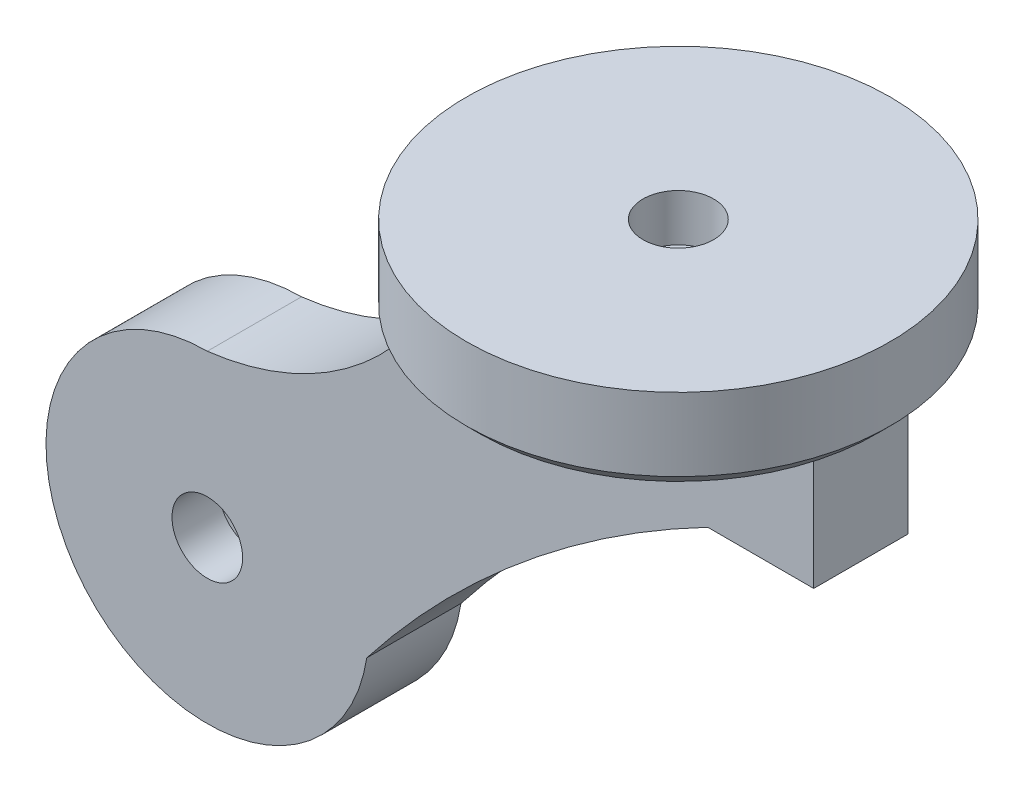
from build123d import *

# Parameters (mm, degrees)
IZIM1_R                        = 90
Y_KSEKLIK_EKSTR_ZYON1_DEPTH    = 37
PAH1_SIZE                      = 6
IZIM2_W                        = 155
IZIM2_H                        = 40
Y_KSEKLIK_EKSTR_ZYON2_DEPTH    = 50
KES_EKSTR_ZYON1_DEPTH          = 151.665191733
Y_KSEKLIK_EKSTR_ZYON4_DEPTH    = 40
Y_KSEKLIK_EKSTR_ZYON5_DEPTH    = 7.5
Y_KSEKLIK_EKSTR_ZYON5_DRAFT    = 70
IZIM14_R                       = 40
Y_KSEKLIK_EKSTR_ZYON6_DEPTH    = 3
IZIM15_R                       = 40
Y_KSEKLIK_EKSTR_ZYON7_DEPTH    = 18
Y_KSEKLIK_EKSTR_ZYON7_TAPER    = 28
KES_EKSTR_ZYON2_REACH          = 366.893
IZIM18_R                       = 1.5
KES_EKSTR_ZYON3_DEPTH          = 5
DAIRESEL_KAPLAMA1_COUNT        = 12
IZIM19_R                       = 22.5
KES_EKSTR_ZYON5_DEPTH          = 7.673092899
KES_EKSTR_ZYON5_DRAFT          = -45
Y_KSEKLIK_EKSTR_ZYON10_DEPTH   = 4
Y_KSEKLIK_EKSTR_ZYON10_DRAFT   = 20
DAIRESEL_KAPLAMA2_COPY_1_DEPTH = 4
DAIRESEL_KAPLAMA2_COPY_1_DRAFT = 20
DAIRESEL_KAPLAMA2_COPY_2_DEPTH = 4
DAIRESEL_KAPLAMA2_COPY_2_DRAFT = 20
DAIRESEL_KAPLAMA2_COPY_3_DEPTH = 4
DAIRESEL_KAPLAMA2_COPY_3_DRAFT = 20
IZIM26_R                       = 11.946565801
Y_KSEKLIK_EKSTR_ZYON16_DEPTH   = 4
Y_KSEKLIK_EKSTR_ZYON16_DRAFT   = -20
IZIM27_R                       = 5
KES_EKSTR_ZYON6_DEPTH          = 4
IZIM28_R                       = 15
KES_EKSTR_ZYON7_DEPTH          = 20
IZIM29_R                       = 15
KES_EKSTR_ZYON8_DEPTH          = 20


with BuildPart() as part:
    # Çizim1 → Yükseklik-Ekstrüzyon1 (new body)
    with BuildSketch(Plane(origin=(0, 0, 0), x_dir=(1, 0, 0), z_dir=(0, 1, 0))):
        with Locations(Location((0, 0, 0), (0, 0, 270))):
            Circle(IZIM1_R)
    extrude(amount=Y_KSEKLIK_EKSTR_ZYON1_DEPTH)

    # Pah1
    pah1_edges = [part.edges().sort_by_distance(p)[0] for p in [
        (0, 0, -90),
    ]]
    chamfer(pah1_edges, length=PAH1_SIZE)

    # Çizim2 → Yükseklik-Ekstrüzyon2 (add)
    with BuildSketch(Plane.XZ):
        Rectangle(IZIM2_W, IZIM2_H)
    extrude(amount=Y_KSEKLIK_EKSTR_ZYON2_DEPTH)

    # Çizim8 → Kes-Ekstrüzyon1 (cut, through all)
    with BuildSketch(Plane(origin=(0, 0, -20), x_dir=(-1, 0, 0), z_dir=(0, 0, -1))):
        with BuildLine():
            Line((77.5, -11), (77.5, -50))
            Line((77.5, -50), (-32.5, -50))
            ThreePointArc((-32.5, -50), (18.551432041, -19.363013449), (77.5, -11))
        make_face()
    extrude(amount=-KES_EKSTR_ZYON1_DEPTH, mode=Mode.SUBTRACT)


with BuildPart() as body_2:
    # Çizim11 → Yükseklik-Ekstrüzyon4 (new body)
    with BuildSketch(Plane(origin=(0, 0, -20), x_dir=(-1, 0, 0), z_dir=(0, 0, -1))):
        with BuildLine():
            ThreePointArc((112.293951988, -170.399089511), (231.983591793, -204.60892494), (180, -91.5))
            ThreePointArc((180, -91.5), (117.428107084, -65.666074831), (77.5, -11))
            ThreePointArc((77.5, -11), (18.551432041, -19.363013449), (-32.5, -50))
            ThreePointArc((-32.5, -50), (46.413512569, -102.362649245), (112.293951988, -170.399089511))
        make_face()
    extrude(amount=-Y_KSEKLIK_EKSTR_ZYON4_DEPTH)


with BuildPart() as y_kseklik_ekstr_zyon5_tool:
    # Çizim12 → Yükseklik-Ekstrüzyon5 (with draft: the straight prism first)
    with BuildSketch(Plane(origin=(0, 0, -20), x_dir=(-1, 0, 0), z_dir=(0, 0, -1))):
        with BuildLine():
            ThreePointArc((77.5, -11), (18.551432041, -19.363013449), (-32.5, -50))
            ThreePointArc((-32.5, -50), (46.413512569, -102.362649245), (112.293951988, -170.399089511))
            ThreePointArc((112.293951988, -170.399089511), (231.983591793, -204.60892494), (180, -91.5))
            ThreePointArc((180, -91.5), (117.428107084, -65.666074831), (77.5, -11))
        make_face()
    extrude(amount=Y_KSEKLIK_EKSTR_ZYON5_DEPTH)
    # Yükseklik-Ekstrüzyon5: the draft: its side faces are tilted about the plane it starts from
    y_kseklik_ekstr_zyon5_sides = [y_kseklik_ekstr_zyon5_tool.faces().sort_by_distance(p)[0] for p in [
        (-18.551432041, -19.363013449, -23.75),
        (-46.413512569, -102.362649245, -23.75),
        (-231.983591793, -204.60892494, -23.75),
        (-117.428107084, -65.666074831, -23.75),
    ]]
    draft(y_kseklik_ekstr_zyon5_sides, Plane(origin=(0, 0, -20), x_dir=(-1, 0, 0), z_dir=(0, 0, -1)), Y_KSEKLIK_EKSTR_ZYON5_DRAFT)


with BuildPart() as part_1:
    add(part.part)

    # Yükseklik-Ekstrüzyon5: add y_kseklik_ekstr_zyon5_tool
    add(y_kseklik_ekstr_zyon5_tool.part)

    add(body_2.part)  # Yükseklik-Ekstrüzyon5 merges body 2

    # Çizim14 → Yükseklik-Ekstrüzyon6 (add)
    with BuildSketch(Plane(origin=(0, 0, -27.5), x_dir=(-1, 0, 0), z_dir=(0, 0, -1))):
        with Locations((178.16629157, -161.872562058)):
            Circle(IZIM14_R)
    extrude(amount=Y_KSEKLIK_EKSTR_ZYON6_DEPTH)

    # Çizim15 → Yükseklik-Ekstrüzyon7 (add)
    with BuildSketch(Plane(origin=(0, 0, -30.5), x_dir=(-1, 0, 0), z_dir=(0, 0, -1))):
        with Locations((178.16629157, -161.872562058)):
            Circle(IZIM15_R)
    extrude(amount=Y_KSEKLIK_EKSTR_ZYON7_DEPTH, taper=Y_KSEKLIK_EKSTR_ZYON7_TAPER)

    # Kes-Ekstrüzyon2: up to this face of the body (flat: up to its plane)
    kes_ekstr_zyon2_end = Plane(part_1.part.faces().sort_by_distance((-113.626570454, -106.060567716, -27.5))[0])
    # Çizim16 → Kes-Ekstrüzyon2 (cut, up to the picked face)
    with BuildSketch(Plane(origin=(0, 0, -48.5), x_dir=(-1, 0, 0), z_dir=(0, 0, -1)), mode=Mode.PRIVATE) as kes_ekstr_zyon2_sk1:
        with BuildLine():
            ThreePointArc((173.362513288, -201.583060849), (178.16629157, -201.872562058), (182.970069853, -201.583060849))
            ThreePointArc((182.970069853, -201.583060849), (182.490394368, -195.947531511), (178.16629157, -192.301792288))
            ThreePointArc((178.16629157, -192.301792288), (173.842188772, -195.947531511), (173.362513288, -201.583060849))
        make_face()
    kes_ekstr_zyon2_tool1 = split(extrude(kes_ekstr_zyon2_sk1.sketch, amount=-KES_EKSTR_ZYON2_REACH, mode=Mode.PRIVATE), bisect_by=kes_ekstr_zyon2_end, keep=Keep.BOTH, mode=Mode.PRIVATE)
    kes_ekstr_zyon2 = kes_ekstr_zyon2_tool1.solids().sort_by(Axis((-178.166292, -197.782755, -48.5), (0, 0, 1)))[0]
    add(kes_ekstr_zyon2, mode=Mode.SUBTRACT)

    # Çizim18 → Kes-Ekstrüzyon3 (cut)
    with BuildSketch(Plane(origin=(0, 0, -27.5), x_dir=(-1, 0, 0), z_dir=(0, 0, -1))):
        with Locations((178.16629157, -196.942426569)):
            Circle(IZIM18_R)
    kes_ekstr_zyon3 = extrude(amount=-KES_EKSTR_ZYON3_DEPTH, mode=Mode.SUBTRACT)

    # Dairesel Kaplama1: Kes-Ekstrüzyon2, Kes-Ekstrüzyon3 ×12 about axis
    dairesel_kaplama1_axis = Axis((-178.16629157, -161.872562058, 0), (0, 0, 1))
    add([kes_ekstr_zyon2.rotate(dairesel_kaplama1_axis, i * 360 / DAIRESEL_KAPLAMA1_COUNT) for i in range(1, DAIRESEL_KAPLAMA1_COUNT)], mode=Mode.SUBTRACT)
    add([kes_ekstr_zyon3.rotate(dairesel_kaplama1_axis, i * 360 / DAIRESEL_KAPLAMA1_COUNT) for i in range(1, DAIRESEL_KAPLAMA1_COUNT)], mode=Mode.SUBTRACT)


with BuildPart() as kes_ekstr_zyon5_tool:
    # Çizim19 → Kes-Ekstrüzyon5 (with draft: the straight prism first)
    with BuildSketch(Plane(origin=(0, 0, -48.5), x_dir=(-1, 0, 0), z_dir=(0, 0, -1))):
        with Locations((178.16629157, -161.872562058)):
            Circle(IZIM19_R)
    extrude(amount=-KES_EKSTR_ZYON5_DEPTH)
    # Kes-Ekstrüzyon5: the draft: its side faces are tilted about the plane it starts from
    kes_ekstr_zyon5_sides = [kes_ekstr_zyon5_tool.faces().sort_by_distance(p)[0] for p in [
        (-155.66629157, -161.872562058, -44.663453551),
    ]]
    draft(kes_ekstr_zyon5_sides, Plane(origin=(0, 0, -48.5), x_dir=(-1, 0, 0), z_dir=(0, 0, -1)), KES_EKSTR_ZYON5_DRAFT)


with BuildPart() as part_2:
    add(part_1.part)

    # Kes-Ekstrüzyon5: cut by kes_ekstr_zyon5_tool
    add(kes_ekstr_zyon5_tool.part, mode=Mode.SUBTRACT)


with BuildPart() as y_kseklik_ekstr_zyon10_tool:
    # Çizim20 → Yükseklik-Ekstrüzyon10 (with draft: the straight prism first)
    with BuildSketch(Plane(origin=(0, 0, -40.826907101), x_dir=(-1, 0, 0), z_dir=(0, 0, -1))):
        with BuildLine():
            ThreePointArc((175.16629157, -153.919575198), (178.16629157, -153.372562058), (181.16629157, -153.919575198))
            Line((181.16629157, -153.919575198), (185.287449999, -143.719350149))
            ThreePointArc((185.287449999, -143.719350149), (178.16629157, -142.372562058), (171.045133141, -143.719350149))
            Line((171.045133141, -143.719350149), (175.16629157, -153.919575198))
        make_face()
    extrude(amount=Y_KSEKLIK_EKSTR_ZYON10_DEPTH)
    # Yükseklik-Ekstrüzyon10: the draft: its side faces are tilted about the plane it starts from
    y_kseklik_ekstr_zyon10_sides = [y_kseklik_ekstr_zyon10_tool.faces().sort_by_distance(p)[0] for p in [
        (-178.16629157, -153.372562058, -42.826907101),
        (-183.226870785, -148.819462674, -42.826907101),
        (-178.16629157, -142.372562058, -42.826907101),
        (-173.105712356, -148.819462674, -42.826907101),
    ]]
    draft(y_kseklik_ekstr_zyon10_sides, Plane(origin=(0, 0, -40.826907101), x_dir=(-1, 0, 0), z_dir=(0, 0, -1)), Y_KSEKLIK_EKSTR_ZYON10_DRAFT)


with BuildPart() as part_3:
    add(part_2.part)

    # Yükseklik-Ekstrüzyon10: add y_kseklik_ekstr_zyon10_tool
    add(y_kseklik_ekstr_zyon10_tool.part)


with BuildPart() as dairesel_kaplama2_copy_1_tool:
    # Dairesel Kaplama2 copy 1 sketch → Dairesel Kaplama2 copy 1 (with draft: the straight prism first)
    with BuildSketch(Plane(origin=(-341.03419606, 15.29838708, -40.826907101), x_dir=(0, -1, 0), z_dir=(0, 0, -1))):
        with BuildLine():
            ThreePointArc((175.16629157, -153.919575198), (178.16629157, -153.372562058), (181.16629157, -153.919575198))
            Line((181.16629157, -153.919575198), (185.287449999, -143.719350149))
            ThreePointArc((185.287449999, -143.719350149), (178.16629157, -142.372562058), (171.045133141, -143.719350149))
            Line((171.045133141, -143.719350149), (175.16629157, -153.919575198))
        make_face()
    extrude(amount=DAIRESEL_KAPLAMA2_COPY_1_DEPTH)
    # Dairesel Kaplama2 copy 1: the draft: its side faces are tilted about the plane it starts from
    dairesel_kaplama2_copy_1_sides = [dairesel_kaplama2_copy_1_tool.faces().sort_by_distance(p)[0] for p in [
        (-187.661634002, -162.86790449, -42.826907101),
        (-192.214733386, -167.928483705, -42.826907101),
        (-198.661634002, -162.86790449, -42.826907101),
        (-192.214733386, -157.807325276, -42.826907101),
    ]]
    draft(dairesel_kaplama2_copy_1_sides, Plane(origin=(-341.03419606, 15.29838708, -40.826907101), x_dir=(0, -1, 0), z_dir=(0, 0, -1)), DAIRESEL_KAPLAMA2_COPY_1_DRAFT)


with BuildPart() as part_4:
    add(part_3.part)

    # Dairesel Kaplama2 copy 1: add dairesel_kaplama2_copy_1_tool
    add(dairesel_kaplama2_copy_1_tool.part)


with BuildPart() as dairesel_kaplama2_copy_2_tool:
    # Dairesel Kaplama2 copy 2 sketch → Dairesel Kaplama2 copy 2 (with draft: the straight prism first)
    with BuildSketch(Plane(origin=(-356.33258314, -325.73580898, -40.826907101), x_dir=(1, 0, 0), z_dir=(0, 0, -1))):
        with BuildLine():
            ThreePointArc((175.16629157, -153.919575198), (178.16629157, -153.372562058), (181.16629157, -153.919575198))
            Line((181.16629157, -153.919575198), (185.287449999, -143.719350149))
            ThreePointArc((185.287449999, -143.719350149), (178.16629157, -142.372562058), (171.045133141, -143.719350149))
            Line((171.045133141, -143.719350149), (175.16629157, -153.919575198))
        make_face()
    extrude(amount=DAIRESEL_KAPLAMA2_COPY_2_DEPTH)
    # Dairesel Kaplama2 copy 2: the draft: its side faces are tilted about the plane it starts from
    dairesel_kaplama2_copy_2_sides = [dairesel_kaplama2_copy_2_tool.faces().sort_by_distance(p)[0] for p in [
        (-178.16629157, -172.363246922, -42.826907101),
        (-173.105712355, -176.916346306, -42.826907101),
        (-178.16629157, -183.363246922, -42.826907101),
        (-183.226870784, -176.916346306, -42.826907101),
    ]]
    draft(dairesel_kaplama2_copy_2_sides, Plane(origin=(-356.33258314, -325.73580898, -40.826907101), x_dir=(1, 0, 0), z_dir=(0, 0, -1)), DAIRESEL_KAPLAMA2_COPY_2_DRAFT)


with BuildPart() as part_5:
    add(part_4.part)

    # Dairesel Kaplama2 copy 2: add dairesel_kaplama2_copy_2_tool
    add(dairesel_kaplama2_copy_2_tool.part)


with BuildPart() as dairesel_kaplama2_copy_3_tool:
    # Dairesel Kaplama2 copy 3 sketch → Dairesel Kaplama2 copy 3 (with draft: the straight prism first)
    with BuildSketch(Plane(origin=(-15.29838708, -341.03419606, -40.826907101), x_dir=(0, 1, 0), z_dir=(0, 0, -1))):
        with BuildLine():
            ThreePointArc((175.16629157, -153.919575198), (178.16629157, -153.372562058), (181.16629157, -153.919575198))
            Line((181.16629157, -153.919575198), (185.287449999, -143.719350149))
            ThreePointArc((185.287449999, -143.719350149), (178.16629157, -142.372562058), (171.045133141, -143.719350149))
            Line((171.045133141, -143.719350149), (175.16629157, -153.919575198))
        make_face()
    extrude(amount=DAIRESEL_KAPLAMA2_COPY_3_DEPTH)
    # Dairesel Kaplama2 copy 3: the draft: its side faces are tilted about the plane it starts from
    dairesel_kaplama2_copy_3_sides = [dairesel_kaplama2_copy_3_tool.faces().sort_by_distance(p)[0] for p in [
        (-168.670949138, -162.86790449, -42.826907101),
        (-164.117849754, -157.807325275, -42.826907101),
        (-157.670949138, -162.86790449, -42.826907101),
        (-164.117849754, -167.928483704, -42.826907101),
    ]]
    draft(dairesel_kaplama2_copy_3_sides, Plane(origin=(-15.29838708, -341.03419606, -40.826907101), x_dir=(0, 1, 0), z_dir=(0, 0, -1)), DAIRESEL_KAPLAMA2_COPY_3_DRAFT)


with BuildPart() as part_6:
    add(part_5.part)

    # Dairesel Kaplama2 copy 3: add dairesel_kaplama2_copy_3_tool
    add(dairesel_kaplama2_copy_3_tool.part)


with BuildPart() as y_kseklik_ekstr_zyon16_tool:
    # Çizim26 → Yükseklik-Ekstrüzyon16 (with draft: the straight prism first)
    with BuildSketch(Plane(origin=(0, 0, -40.826907101), x_dir=(-1, 0, 0), z_dir=(0, 0, -1))):
        with Locations((177.170949138, -162.86790449)):
            Circle(IZIM26_R)
    extrude(amount=Y_KSEKLIK_EKSTR_ZYON16_DEPTH)
    # Yükseklik-Ekstrüzyon16: the draft: its side faces are tilted about the plane it starts from
    y_kseklik_ekstr_zyon16_sides = [y_kseklik_ekstr_zyon16_tool.faces().sort_by_distance(p)[0] for p in [
        (-165.224383338, -162.86790449, -42.826907101),
    ]]
    draft(y_kseklik_ekstr_zyon16_sides, Plane(origin=(0, 0, -40.826907101), x_dir=(-1, 0, 0), z_dir=(0, 0, -1)), Y_KSEKLIK_EKSTR_ZYON16_DRAFT)


with BuildPart() as part_7:
    add(part_6.part)

    # Yükseklik-Ekstrüzyon16: add y_kseklik_ekstr_zyon16_tool
    add(y_kseklik_ekstr_zyon16_tool.part)

    # Çizim27 → Kes-Ekstrüzyon6 (cut)
    with BuildSketch(Plane(origin=(0, 0, -44.826907101), x_dir=(-1, 0, 0), z_dir=(0, 0, -1))):
        with Locations((177.170949138, -162.86790449)):
            Circle(IZIM27_R)
    extrude(amount=-KES_EKSTR_ZYON6_DEPTH, mode=Mode.SUBTRACT)

    # Çizim28 → Kes-Ekstrüzyon7 (cut)
    with BuildSketch(Plane.XY.offset(20)):
        with Locations((-180, -160)):
            Circle(IZIM28_R)
    extrude(amount=-KES_EKSTR_ZYON7_DEPTH, mode=Mode.SUBTRACT)

    # Çizim29 → Kes-Ekstrüzyon8 (cut)
    with BuildSketch(Plane(origin=(0, 37, 0), x_dir=(1, 0, 0), z_dir=(0, 1, 0))):
        with Locations(Location((0, 0, 0), (0, 0, 270))):
            Circle(IZIM29_R)
    extrude(amount=-KES_EKSTR_ZYON8_DEPTH, mode=Mode.SUBTRACT)


solid = part_7.part
